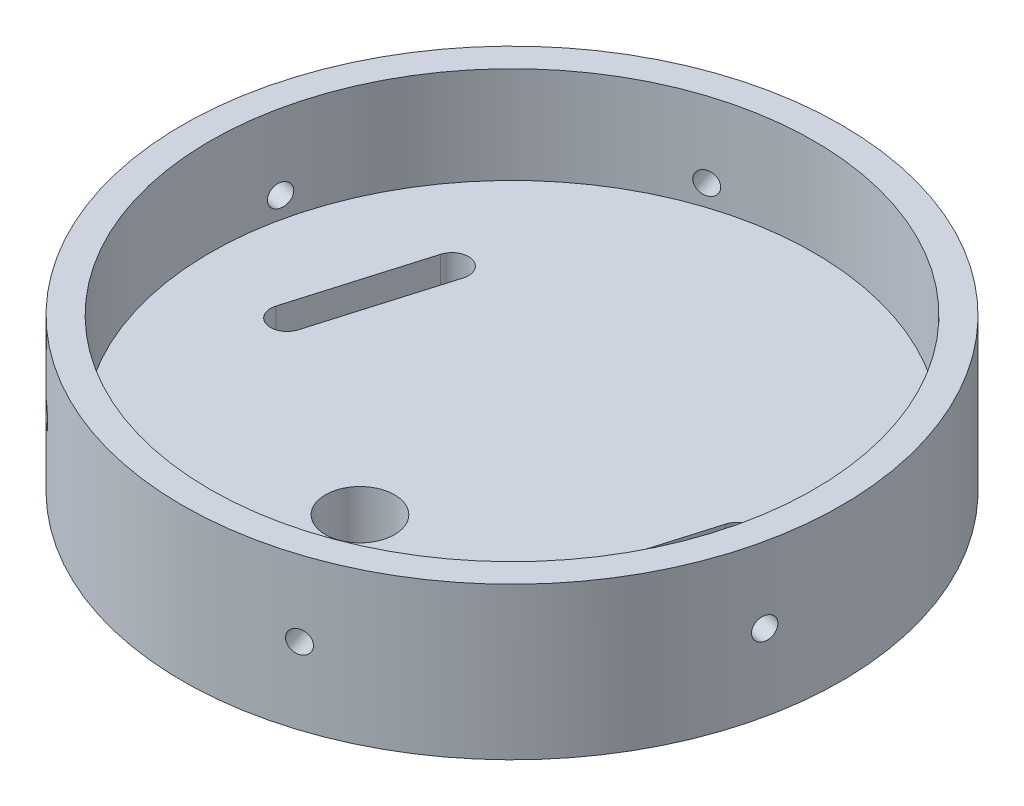
from build123d import *

# Parameters (mm, degrees)
SKETCH1_R                            = 75.692
SKETCH1_R_2                          = 69.342
BOSS_EXTRUDE1_DEPTH                  = 22.225
BOSS_EXTRUDE2_START                  = 12.7
SKETCH2_R                            = 75.692
BOSS_EXTRUDE2_DEPTH                  = 12.7
TAP_DRILL_FOR_1_4_20_TAP1_AT_2_COUNT = 2
TAP_DRILL_FOR_1_4_20_TAP1_AT_2_PITCH = 53.488399339
CIRPATTERN1_COUNT                    = 6
F_5_8_0_625_DIAMETER_HOLE1_D         = 15.875
CUT_EXTRUDE1_DEPTH                   = 110.327528042


with BuildPart() as part:
    # Sketch1 → Boss-Extrude1 (new body)
    with BuildSketch(Plane(origin=(0, 0, 0), x_dir=(1, 0, 0), z_dir=(0, 1, 0))):
        Circle(SKETCH1_R)
        Circle(SKETCH1_R_2, mode=Mode.SUBTRACT)
    extrude(amount=BOSS_EXTRUDE1_DEPTH)

    # Sketch2 → Boss-Extrude2 (add)
    with BuildSketch(Plane.XZ.offset(BOSS_EXTRUDE2_START)):
        Circle(SKETCH2_R)
    extrude(amount=-BOSS_EXTRUDE2_DEPTH)

    # Sketch4 → Tap Drill for 1/4-20 Tap1 (revolve, cut)
    with BuildSketch(Plane(origin=(73.997176623, 4.896298223, 15.927859738), x_dir=(0.21042989666546502, 0, -0.9776089497285517), z_dir=(0, 1, 0))):
        Polygon((0, 0), (0, 11.185816902), (2.5527, 9.652), (2.5527, 0), align=None)
    tap_drill_for_1_4_20_tap1 = revolve(axis=Axis((80.204993454, 4.896298223, 17.264089582), (-0.9776089497285516, 0, -0.210429896665465)), mode=Mode.SUBTRACT)

    # Tap Drill for 1/4-20 Tap1 at 2: Tap Drill for 1/4-20 Tap1 ×2
    with Locations(*[Vector(-0.1104385806360645, 0.8512109993044242, 0.5130722703189632) * (i * TAP_DRILL_FOR_1_4_20_TAP1_AT_2_PITCH) for i in range(1, TAP_DRILL_FOR_1_4_20_TAP1_AT_2_COUNT)]):
        add(tap_drill_for_1_4_20_tap1, mode=Mode.SUBTRACT)

    # CirPattern1: Tap Drill for 1/4-20 Tap1 ×6 about axis
    cirpattern1_axis = Axis((0, 22.225, 0), (0, -1, 0))
    for i in range(1, CIRPATTERN1_COUNT):
        add(tap_drill_for_1_4_20_tap1.rotate(cirpattern1_axis, i * 360 / CIRPATTERN1_COUNT), mode=Mode.SUBTRACT)

    # CirPattern1 copy 1 sketch → CirPattern1 copy 1 (revolve, cut)
    with BuildSketch(Plane(origin=(-3.515628412, 50.426212075, 80.653301416), x_dir=(0.9518491337646824, 0, -0.30656683863624895), z_dir=(0, 1, 0))):
        Polygon((0, 0), (0, 11.185816902), (2.5527, 9.652), (2.5527, 0), align=None)
    revolve(axis=Axis((-1.568928987, 50.426212075, 86.697543415), (-0.3065668386362489, 0, -0.9518491337646823)), mode=Mode.SUBTRACT)

    # CirPattern1 copy 2 sketch → CirPattern1 copy 2 (revolve, cut)
    with BuildSketch(Plane(origin=(-71.605622131, 50.426212075, 37.282027193), x_dir=(0.7414192370992175, 0, 0.6710421110923027), z_dir=(0, 1, 0))):
        Polygon((0, 0), (0, 11.185816902), (2.5527, 9.652), (2.5527, 0), align=None)
    revolve(axis=Axis((-75.866739537, 50.426212075, 41.990039348), (0.6710421110923026, 0, -0.7414192370992174)), mode=Mode.SUBTRACT)

    # CirPattern1 copy 3 sketch → CirPattern1 copy 3 (revolve, cut)
    with BuildSketch(Plane(origin=(-68.089993719, 50.426212075, -43.371274223), x_dir=(-0.2104298966654649, 0, 0.9776089497285517), z_dir=(0, 1, 0))):
        Polygon((0, 0), (0, 11.185816902), (2.5527, 9.652), (2.5527, 0), align=None)
    revolve(axis=Axis((-74.29781055, 50.426212075, -44.707504067), (0.9776089497285516, 0, 0.21042989666546488)), mode=Mode.SUBTRACT)

    # CirPattern1 copy 4 sketch → CirPattern1 copy 4 (revolve, cut)
    with BuildSketch(Plane(origin=(3.515628412, 50.426212075, -80.653301416), x_dir=(-0.9518491337646823, 0, 0.30656683863624934), z_dir=(0, 1, 0))):
        Polygon((0, 0), (0, 11.185816902), (2.5527, 9.652), (2.5527, 0), align=None)
    revolve(axis=Axis((1.568928987, 50.426212075, -86.697543415), (0.3065668386362493, 0, 0.9518491337646823)), mode=Mode.SUBTRACT)

    # CirPattern1 copy 5 sketch → CirPattern1 copy 5 (revolve, cut)
    with BuildSketch(Plane(origin=(71.605622131, 50.426212075, -37.282027193), x_dir=(-0.7414192370992174, 0, -0.671042111092303), z_dir=(0, 1, 0))):
        Polygon((0, 0), (0, 11.185816902), (2.5527, 9.652), (2.5527, 0), align=None)
    revolve(axis=Axis((75.866739537, 50.426212075, -41.990039348), (-0.6710421110923029, 0, 0.7414192370992173)), mode=Mode.SUBTRACT)

    # 5/8 (0.625) Diameter Hole1 (through all)
    with Locations(Plane(origin=(0, 0, 0), x_dir=(1, 0, 0), z_dir=(0, 1, 0))):
        with Locations((0, -34.925)):
            Hole(F_5_8_0_625_DIAMETER_HOLE1_D / 2)

    # Sketch11 → Cut-Extrude1 (cut, through all)
    with BuildSketch(Plane(origin=(0, 0, 0), x_dir=(1, 0, 0), z_dir=(0, 1, 0))):
        with BuildLine():
            Line((-51.165057741, -3.071167846), (-42.54303006, 26.163931584))
            ThreePointArc((-42.54303006, 26.163931584), (-37.810889171, 28.740565552), (-35.234255202, 24.008424663))
            Line((-35.234255202, 24.008424663), (-43.856282883, -5.226674766))
            ThreePointArc((-43.856282883, -5.226674766), (-48.588423772, -7.803308735), (-51.165057741, -3.071167846))
        make_face()
        with BuildLine():
            Line((35.234255202, -24.008424663), (43.856282883, 5.226674766))
            ThreePointArc((43.856282883, 5.226674766), (48.588423772, 7.803308735), (51.165057741, 3.071167846))
            Line((51.165057741, 3.071167846), (42.54303006, -26.163931584))
            ThreePointArc((42.54303006, -26.163931584), (37.810889171, -28.740565552), (35.234255202, -24.008424663))
        make_face()
    extrude(amount=-CUT_EXTRUDE1_DEPTH, mode=Mode.SUBTRACT)


solid = part.part
